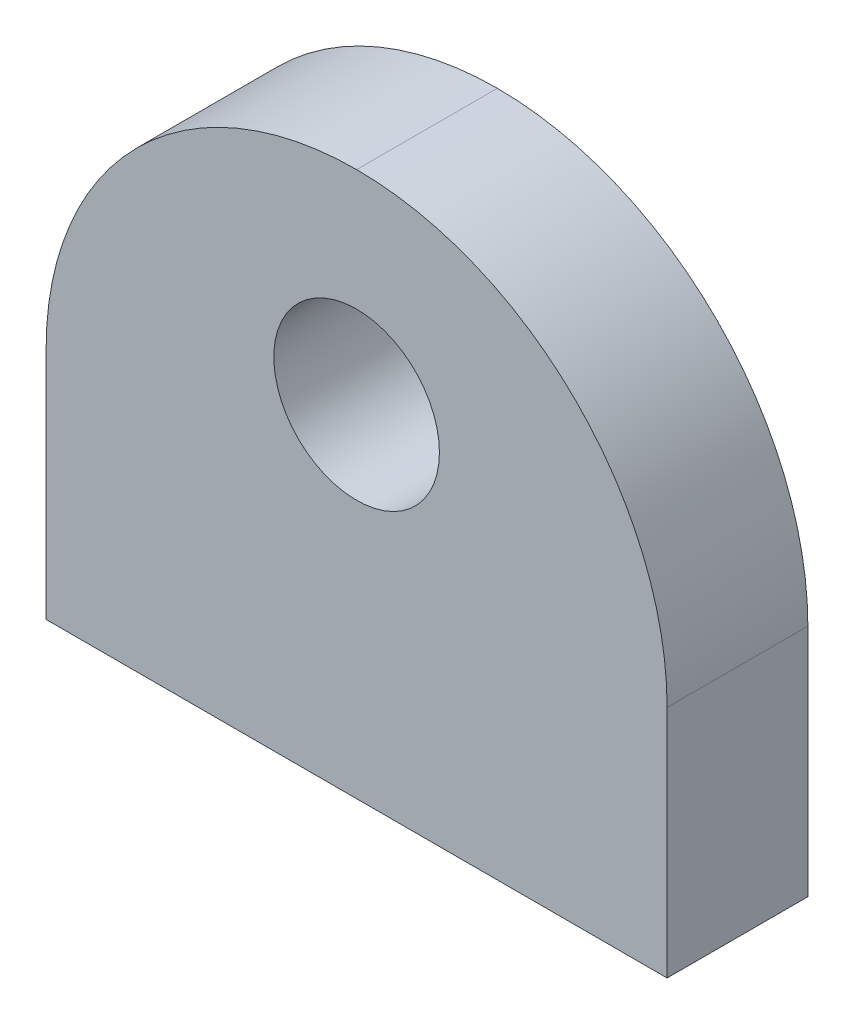
from build123d import *

# Parameters (mm, degrees)
CROQUIS1_W              = 30
CROQUIS1_H              = 26.322580645
SALIENTE_EXTRUIR1_DEPTH = 6.8
REDONDEO1_R             = 15
CORTAR_EXTRUIR1_REACH   = 42.486
CROQUIS2_R              = 4


with BuildPart() as part:
    # Croquis1 → Saliente-Extruir1 (new body)
    with BuildSketch(Plane.XY):
        with Locations((15, 13.161290323)):
            Rectangle(CROQUIS1_W, CROQUIS1_H)
    extrude(amount=SALIENTE_EXTRUIR1_DEPTH)

    # Redondeo1
    redondeo1_edges = [part.edges().sort_by_distance(p)[0] for p in [
        (0, 26.322580645, 3.4),
        (30, 26.322580645, 3.4),
    ]]
    fillet(redondeo1_edges, radius=REDONDEO1_R - 0.0001)  # a hair under: the kernel refuses the full size

    # Croquis2 → Cortar-Extruir1 (cut, up to next)
    with BuildSketch(Plane.XY.offset(6.8), mode=Mode.PRIVATE) as cortar_extruir1_sk1:
        with Locations((15, 16.485572524)):
            Circle(CROQUIS2_R)
    cortar_extruir1_tool1 = extrude(cortar_extruir1_sk1.sketch, amount=-CORTAR_EXTRUIR1_REACH, mode=Mode.PRIVATE) & part.part
    add(cortar_extruir1_tool1.solids().sort_by_distance((15, 16.485573, 6.8))[0], mode=Mode.SUBTRACT)


solid = part.part
